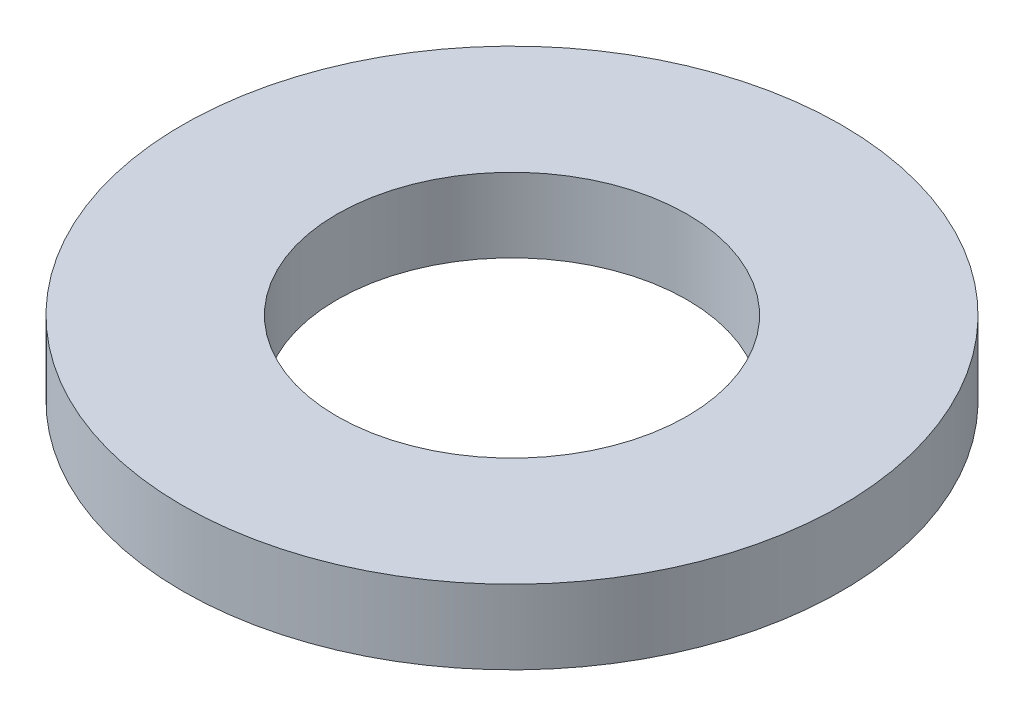
from build123d import *

# Parameters (mm, degrees)
SKETCH1_R           = 80
BOSS_EXTRUDE1_DEPTH = 18
SKETCH2_R           = 42.5
CUT_EXTRUDE1_DEPTH  = 115.560027933


with BuildPart() as part:
    # Sketch1 → Boss-Extrude1 (new body)
    with BuildSketch(Plane(origin=(0, 0, 0), x_dir=(1, 0, 0), z_dir=(0, 1, 0))):
        Circle(SKETCH1_R)
    extrude(amount=BOSS_EXTRUDE1_DEPTH)

    # Sketch2 → Cut-Extrude1 (cut, through all)
    with BuildSketch(Plane(origin=(0, 0, 0), x_dir=(1, 0, 0), z_dir=(0, 1, 0))):
        Circle(SKETCH2_R)
    extrude(amount=CUT_EXTRUDE1_DEPTH, mode=Mode.SUBTRACT)


solid = part.part
